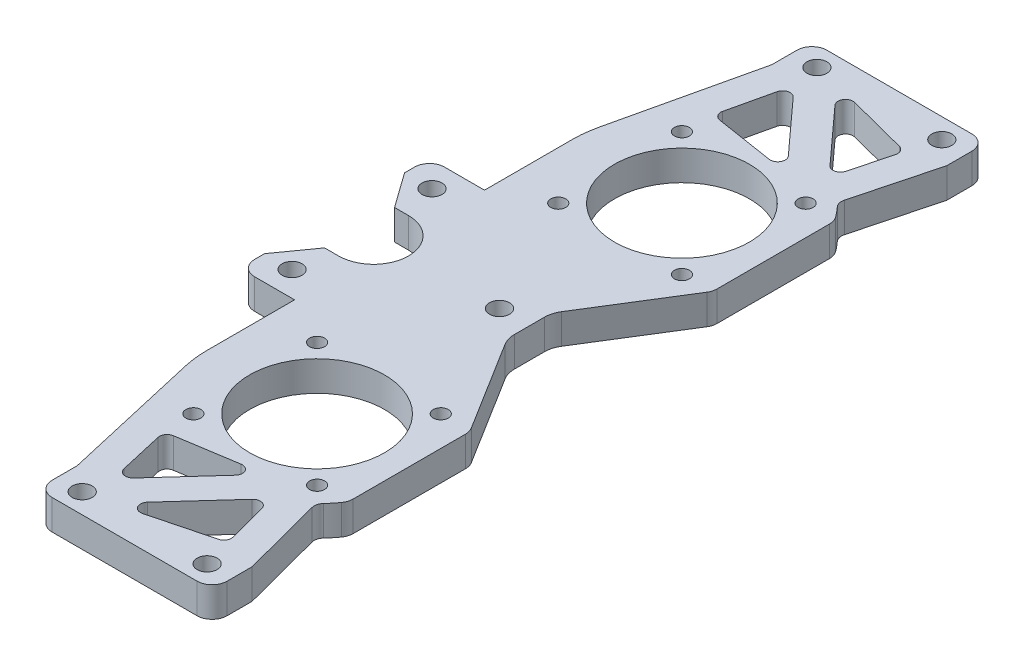
from build123d import *
from build123d.topology import SkipClean

# Parameters (mm, degrees)
SKETCH_1_W           = 44
SKETCH_1_H           = 131
SKETCH_1_R           = 1.6000000000000012
SKETCH_1_R_2         = 1.5999999999999979
SKETCH_1_R_3         = 1.5999999999999954
SKETCH_1_R_4         = 1.5999999999999988
SKETCH_1_H_2         = 9.999999999999986
SKETCH_1_R_5         = 1.600000000000003
SKETCH_1_R_6         = 1.600000000000006
EXTRUDE_1_DEPTH      = 6
SKETCH_2_R           = 2.300000000007249
EXTRUDE_2_DEPTH      = 6
CUT_EXTRUDE_1_DEPTH  = 6
FILLET_1_R           = 5
CUT_EXTRUDE_2_DEPTH  = 6
FILLET_2_R           = 2
SKETCH_4_R           = 1.5999999999999954
SKETCH_4_R_2         = 1.5999999999999985
SKETCH_4_R_3         = 1.5999999999999968
EXTRUDE_3_DEPTH      = 6
SKETCH_5_R           = 1.500000000006792
SKETCH_5_R_2         = 1.5000000000067926
EXTRUDE_4_DEPTH      = 6
CUT_EXTRUDE_3_DEPTH  = 6
EXTRUDE_5_DEPTH      = 6
CUT_EXTRUDE_4_DEPTH  = 10
CHAMFER_1_SIZE       = 4
CUT_EXTRUDE_5_DEPTH  = 10
SKETCH_8_R           = 7.000000000006796
CUT_EXTRUDE_6_DEPTH  = 10
SKETCH_11_R          = 2.100000000000002
EXTRUDE_6_DEPTH      = 6
SKETCH_9_R           = 7.499999999999999
CUT_EXTRUDE_7_DEPTH  = 10
SKETCH_10_W          = 32.19999999999607
SKETCH_10_H          = 60
CUT_EXTRUDE_8_DEPTH  = 10
CUT_EXTRUDE_10_DEPTH = 10
SKETCH_14_R          = 2.1
CUT_EXTRUDE_11_DEPTH = 10
EXTRUDE_7_DEPTH      = 6
FILLET_4_R           = 3
FILLET_5_R           = 3
SKETCH_18_R          = 1.600000000000006
SKETCH_18_R_2        = 2.100000000000005
SKETCH_18_R_3        = 1.6000000000000043
EXTRUDE_9_DEPTH      = 6
SKETCH_17_R          = 2.1
SKETCH_17_R_2        = 2
SKETCH_17_R_3        = 2.3000000000072487
SKETCH_17_R_4        = 1.9999999999999996
SKETCH_17_R_5        = 1.5999999999999968
SKETCH_17_R_6        = 1.4999999999999991
SKETCH_17_R_7        = 1.5999999999999985
SKETCH_17_R_8        = 1.5000000000000009
SKETCH_17_R_9        = 1.5999999999999974
SKETCH_17_R_10       = 1.6000000000000043
SKETCH_17_R_11       = 2.1000000000000085
SKETCH_17_R_12       = 1.9999999999999936
SKETCH_17_R_13       = 2.100000000000005
SKETCH_17_R_14       = 2.0999999999999988
SKETCH_17_R_15       = 2.100000000000027
SKETCH_17_R_16       = 1.6000000000000276
SKETCH_17_R_17       = 1.6000000000000207
SKETCH_17_R_18       = 1.6000000000000105
SKETCH_17_R_19       = 1.6000000000000045
SKETCH_17_R_20       = 2.3000000000120995
EXTRUDE_8_DEPTH      = 6
SKETCH_20_R          = 2.0000000000000018
CUT_EXTRUDE_12_DEPTH = 87.96694774453113
CUT_EXTRUDE_13_DEPTH = 85.44672877027268
FILLET_6_R           = 3


with BuildPart() as part:
    # 草图1 → 凸台-拉伸1 (new body)
    # profile 1 of 3: a face of its own
    with BuildSketch(Plane(origin=(0, 0, 0), x_dir=(1, 0, 0), z_dir=(0, 1, 0))):
        Rectangle(SKETCH_1_W, SKETCH_1_H)
        with Locations(Location((-12.374368670764605, -48.874368670764554, 0), (0, 0, 270))):
            Circle(SKETCH_1_R, mode=Mode.SUBTRACT)
        with Locations(Location((-12.374368670764358, -24.125631329235514, 0), (0, 0, 270))):
            Circle(SKETCH_1_R_2, mode=Mode.SUBTRACT)
        with Locations(Location((12.374368670764607, -48.874368670764895, 0), (0, 0, 270))):
            Circle(SKETCH_1_R_3, mode=Mode.SUBTRACT)
        with BuildLine():
            ThreePointArc((13.5, -36.5), (-9.545941546018376, -46.045941546018405), (-3.814e-14, -23))
            ThreePointArc((-3.814e-14, -23), (9.545941546018378, -26.954058453981595), (13.5, -36.5))
        make_face(mode=Mode.SUBTRACT)
        with Locations(Location((12.374368670764863, -24.125631329235695, 0), (0, 0, 270))):
            Circle(SKETCH_1_R_4, mode=Mode.SUBTRACT)
        with Locations(Location((-12.374368670764358, 24.125631329235514, 0), (0, 0, 270))):
            Circle(SKETCH_1_R_2, mode=Mode.SUBTRACT)
        with Locations(Location((-12.374368670764605, 48.874368670764554, 0), (0, 0, 270))):
            Circle(SKETCH_1_R, mode=Mode.SUBTRACT)
        with BuildLine():
            ThreePointArc((13.5, 36.5), (9.545941546018373, 26.954058453981588), (-5.044e-14, 23))
            ThreePointArc((-5.044e-14, 23), (-9.545941546018375, 46.04594154601841), (13.5, 36.5))
        make_face(mode=Mode.SUBTRACT)
        with Locations(Location((12.374368670764863, 24.125631329235695, 0), (0, 0, 270))):
            Circle(SKETCH_1_R_4, mode=Mode.SUBTRACT)
        with Locations(Location((12.374368670764607, 48.874368670764895, 0), (0, 0, 270))):
            Circle(SKETCH_1_R_3, mode=Mode.SUBTRACT)
    # profile 2 of 3: a face of its own
    with BuildSketch(Plane(origin=(0, 0, 0), x_dir=(1, 0, 0), z_dir=(0, 1, 0))):
        with Locations((0, 70.5)):
            Rectangle(SKETCH_1_W, SKETCH_1_H_2)
        with Locations(Location((-16.999999999999996, 70.5, 0), (0, 0, 270))):
            Circle(SKETCH_1_R_5, mode=Mode.SUBTRACT)
        with Locations(Location((16.999999999999996, 70.5, 0), (0, 0, 270))):
            Circle(SKETCH_1_R_6, mode=Mode.SUBTRACT)
    # profile 3 of 3: a face of its own
    with BuildSketch(Plane(origin=(0, 0, 0), x_dir=(1, 0, 0), z_dir=(0, 1, 0))):
        with Locations((0, -70.5)):
            Rectangle(SKETCH_1_W, SKETCH_1_H_2)
        with Locations(Location((-16.999999999999996, -70.5, 0), (0, 0, 270))):
            Circle(SKETCH_1_R_5, mode=Mode.SUBTRACT)
        with Locations(Location((16.999999999999996, -70.5, 0), (0, 0, 270))):
            Circle(SKETCH_1_R_6, mode=Mode.SUBTRACT)
    extrude(amount=EXTRUDE_1_DEPTH)

    # 草图2 → 凸台-拉伸2 (add)
    with BuildSketch(Plane.XZ):
        Polygon((-21.999999999999996, -19.000000000000007), (-22, 0), (-22, 18.999999999999993), (-33, 18.999999999999996), (-32.99999999999999, -19.00000000000001), align=None)
        with Locations(Location((-27.499999999996053, -13.999999999991697, 0), (0, 0, 270))):
            Circle(SKETCH_2_R, mode=Mode.SUBTRACT)
        with Locations(Location((-27.499999999996067, 14.000000000008303, 0), (0, 0, 270))):
            Circle(SKETCH_2_R, mode=Mode.SUBTRACT)
    extrude(amount=-EXTRUDE_2_DEPTH)

    # 草图2<3> → 切除-拉伸1 (cut)
    with BuildSketch(Plane.XZ):
        Polygon((5.999999999999998, 7.999999999999997), (5.999999999999998, -2.35e-15), (22, 0), (22, 8.000000000000002), align=None)
        Polygon((22, 0), (5.9999999999999964, 0), (5.999999999999999, -8.000000000000002), (22, -8.000000000000002), align=None)
    extrude(amount=-CUT_EXTRUDE_1_DEPTH, mode=Mode.SUBTRACT)

    # 圆角1
    fillet_1_edges = [part.edges().sort_by_distance(p)[0] for p in [
        (5.999999999999999, 3, -8.000000000000002),
        (5.999999999999999, 3, 7.999999999999998),
        (22, 3, 8.000000000000002),
        (22, 3, -8.000000000000002),
    ]]
    fillet(fillet_1_edges, radius=FILLET_1_R)

    # 草图3 → 切除-拉伸2 (cut)
    with BuildSketch(Plane.XZ):
        with BuildLine():
            ThreePointArc((-22, 36.5), (-20.144860004859353, 45.34220647715366), (-14.892307692307439, 52.69318287421101))
            Line((-14.892307692307686, 52.69318287421078), (-21.999999999999993, 60.42174742781138))
            Line((-22, 60.42174742781138), (-22, 36.49999999999999))
        make_face()
        with BuildLine():
            Line((-15.05896435190986, 65.30065264274246), (-10.193760484369747, 55.99582640431797))
            ThreePointArc((-10.193760484369832, 55.995826404317924), (1.35e-15, 58.5), (10.19376048436984, 55.995826404317924))
            Line((10.193760484369749, 55.99582640431797), (15.05896435190986, 65.30065264274246))
            ThreePointArc((15.058964351909855, 65.30065264274245), (1.99e-15, 69), (-15.058964351909852, 65.30065264274246))
        make_face()
        with BuildLine():
            Line((22, 60.42174742781138), (14.89230769230769, 52.69318287421078))
            ThreePointArc((14.89230769230745, 52.693182874211), (20.144860004859353, 45.34220647715365), (22, 36.5))
            Line((22, 36.5), (22, 60.42174742781138))
        make_face()
        with BuildLine():
            Line((-22, -36.50000000000003), (-22, -60.4217474278114))
            Line((-21.999999999999982, -60.4217474278114), (-14.892307692307668, -52.693182874210784))
            ThreePointArc((-14.892307692307435, -52.69318287421101), (-20.14486000485934, -45.34220647715367), (-21.999999999999986, -36.500000000000014))
        make_face()
        with BuildLine():
            ThreePointArc((-15.05896435190985, -65.30065264274245), (7.91e-15, -69), (15.058964351909868, -65.30065264274246))
            Line((15.058964351909875, -65.30065264274249), (10.193760484369765, -55.995826404317995))
            ThreePointArc((10.193760484369836, -55.99582640431795), (9.84e-15, -58.500000000000014), (-10.193760484369815, -55.995826404317945))
            Line((-10.193760484369738, -55.995826404317995), (-15.058964351909848, -65.30065264274249))
        make_face()
        with BuildLine():
            Line((14.892307692307709, -52.69318287421079), (22.000000000000014, -60.42174742781138))
            Line((22, -60.42174742781138), (22, -36.500000000000014))
            ThreePointArc((22.000000000000014, -36.50000000000002), (20.144860004859343, -45.34220647715373), (14.89230769230737, -52.6931828742111))
        make_face()
    extrude(amount=-CUT_EXTRUDE_2_DEPTH, mode=Mode.SUBTRACT)

    # 圆角2
    fillet_2_edges = [part.edges().sort_by_distance(p)[0] for p in [
        (14.892307692307567, 3, 52.69318287421088),
        (22, 3, 60.42174742781138),
        (10.193760484369793, 3, 55.995826404317945),
        (-10.19376048436979, 3, 55.995826404317945),
        (-15.058964351909859, 3, 65.30065264274246),
        (15.058964351909859, 3, 65.30065264274245),
        (15.058964351909871, 3, -65.30065264274248),
        (-15.058964351909848, 3, -65.30065264274248),
        (-10.193760484369776, 3, -55.99582640431797),
        (10.1937604843698, 3, -55.995826404317974),
        (-14.892307692307549, 3, -52.69318287421089),
        (-21.999999999999993, 3, -60.4217474278114),
        (22.000000000000007, 3, -60.42174742781138),
        (14.892307692307536, 3, -52.69318287421095),
        (-14.892307692307563, 3, 52.6931828742109),
        (-21.999999999999996, 3, 60.42174742781138),
        (-22, 3, -75.49999999999999),
        (22, 3, -75.49999999999999),
        (22, 3, 75.49999999999999),
        (-22, 3, 75.49999999999999),
    ]]
    fillet(fillet_2_edges, radius=FILLET_2_R)

    # 草图4 → 凸台-拉伸3 (add)
    with BuildSketch(Plane.XZ):
        Polygon((-32.99999999999999, -30), (-32.99999999999999, 29.999999999999993), (-55, 29.999999999999993), (-55, -30.000000000000007), align=None)
        with Locations(Location((-37.99999999999999, 24.999999999999993, 0), (0, 0, 270))):
            Circle(SKETCH_4_R, mode=Mode.SUBTRACT)
        with Locations(Location((-50, -25.000000000000007, 0), (0, 0, 270))):
            Circle(SKETCH_4_R_2, mode=Mode.SUBTRACT)
        with Locations(Location((-38.00000000000001, -25.000000000000007, 0), (0, 0, 270))):
            Circle(SKETCH_4_R_3, mode=Mode.SUBTRACT)
        with Locations(Location((-50, 24.999999999999993, 0), (0, 0, 270))):
            Circle(SKETCH_4_R_2, mode=Mode.SUBTRACT)
    extrude(amount=-EXTRUDE_3_DEPTH)

    # 草图5 → 凸台-拉伸4 (add)
    with BuildSketch(Plane.XZ):
        Polygon((-55, 14.999999999999984), (-65.19999999999607, 14.999999999999984), (-65.19999999999607, -15.000000000000009), (-55, -15.00000000000001), align=None)
        with Locations(Location((-61.19999999999606, -10.000000000000007, 0), (0, 0, 270))):
            Circle(SKETCH_5_R, mode=Mode.SUBTRACT)
        with Locations(Location((-61.19999999999606, 9.999999999999984, 0), (0, 0, 270))):
            Circle(SKETCH_5_R_2, mode=Mode.SUBTRACT)
    extrude(amount=-EXTRUDE_4_DEPTH)

    # 草图5<4> → 切除-拉伸3 (cut)
    with BuildSketch(Plane.XZ):
        with BuildLine():
            ThreePointArc((-34.000000000002835, 9.999999999999986), (-33.56066017178066, 8.939339828215356), (-32.49999999999603, 8.499999999993197))
            Line((-32.49999999999605, 8.499999999993197), (-32.49999999999605, 9.999999999999986))
            Line((-32.49999999999605, 9.999999999999986), (-34.000000000002835, 9.999999999999986))
        make_face()
        with BuildLine():
            Line((-32.49999999999605, 9.999999999999986), (-32.49999999999605, 8.499999999993197))
            ThreePointArc((-32.49999999999603, 8.499999999993197), (-31.43933982821142, 8.93933982821537), (-30.99999999998926, 9.999999999999986))
            ThreePointArc((-30.99999999998926, 9.999999999999986), (-32.49999999999605, 11.500000000006775), (-34.000000000002835, 9.999999999999986))
            Line((-34.000000000002835, 9.999999999999986), (-32.49999999999605, 9.999999999999986))
        make_face()
        with BuildLine():
            ThreePointArc((-30.99999999998926, -10.000000000000012), (-31.439339828211423, -8.939339828215395), (-32.499999999996035, -8.499999999993223))
            Line((-32.49999999999605, -8.499999999993221), (-32.49999999999605, -10.000000000000014))
            Line((-32.49999999999605, -10.000000000000012), (-34.000000000002835, -10.000000000000012))
            ThreePointArc((-34.000000000002835, -10.000000000000012), (-32.49999999999605, -11.500000000006802), (-30.99999999998926, -10.000000000000012))
        make_face()
        with BuildLine():
            Line((-32.49999999999605, -10.000000000000014), (-32.49999999999605, -8.499999999993221))
            ThreePointArc((-32.499999999996035, -8.499999999993223), (-33.56066017178067, -8.939339828215386), (-34.000000000002835, -10.000000000000012))
            Line((-34.000000000002835, -10.000000000000012), (-32.49999999999605, -10.000000000000012))
        make_face()
    extrude(amount=-CUT_EXTRUDE_3_DEPTH, mode=Mode.SUBTRACT)

    # 草图6 → 凸台-拉伸5 (add)
    with BuildSketch(Plane(origin=(0, 6, 0), x_dir=(1, 0, 0), z_dir=(0, 1, 0))):
        with BuildLine():
            Line((-12, 77.49999999999999), (-12, 75.49999999999999))
            Line((-12, 75.49999999999999), (-10.640312423743215, 75.49999999999999))
            ThreePointArc((-10.640312423743223, 75.50000000000004), (-9.999999999999943, 75.60000000000002), (-9.35968757625667, 75.5))
            Line((-9.359687576256672, 75.49999999999999), (5.359687576256704, 75.49999999999999))
            ThreePointArc((5.359687576256699, 75.50000000000001), (6.000000000000013, 75.60000000000002), (6.640312423743326, 75.5))
            Line((6.640312423743325, 75.49999999999999), (12, 75.49999999999999))
            Line((12, 75.49999999999999), (12, 77.49999999999999))
            Line((12, 77.49999999999999), (-12, 77.49999999999999))
        make_face()
        with BuildLine():
            Line((11.999999999999973, -77.49999999999999), (11.999999999999973, -75.49999999999999))
            Line((11.999999999999972, -75.49999999999999), (6.6403124237433, -75.49999999999999))
            ThreePointArc((6.640312423743301, -75.5), (5.999999999999985, -75.60000000000002), (5.35968757625667, -75.50000000000001))
            Line((5.359687576256675, -75.49999999999999), (-9.359687576256718, -75.49999999999999))
            ThreePointArc((-9.359687576256716, -75.5), (-10.000000000000162, -75.60000000000002), (-10.640312423743598, -75.49999999999993))
            Line((-10.640312423743605, -75.49999999999999), (-12.000000000000043, -75.49999999999999))
            Line((-12.000000000000043, -75.49999999999999), (-12.000000000000043, -77.49999999999999))
            Line((-12.000000000000043, -77.49999999999999), (11.999999999999972, -77.49999999999999))
        make_face()
    extrude(amount=-EXTRUDE_5_DEPTH)

    # 草图6<3> → 切除-拉伸4 (cut)
    with SkipClean():  # the faces are left unmerged after this step: merging them gives an invalid solid
        with BuildSketch(Plane(origin=(0, 6, 0), x_dir=(1, 0, 0), z_dir=(0, 1, 0))):
            with BuildLine():
                ThreePointArc((-10.640312423743598, -75.49999999999993), (-10.000000000000162, -75.60000000000002), (-9.359687576256716, -75.5))
                Line((-9.359687576256718, -75.49999999999999), (-10.640312423743605, -75.49999999999999))
            make_face()
            with BuildLine():
                Line((-10.640312423743605, -75.49999999999999), (-9.359687576256718, -75.49999999999999))
                ThreePointArc((-9.359687576256716, -75.5), (-8.303731140140114, -74.73801129036433), (-7.900000000000038, -73.50000000000001))
                ThreePointArc((-7.900000000000038, -73.50000000000001), (-11.23801129036426, -71.80373114014002), (-10.640312423743598, -75.49999999999993))
            make_face()
            with BuildLine():
                ThreePointArc((5.35968757625667, -75.50000000000001), (5.999999999999985, -75.60000000000002), (6.640312423743301, -75.5))
                Line((6.6403124237433, -75.49999999999999), (5.359687576256675, -75.49999999999999))
            make_face()
            with BuildLine():
                Line((5.359687576256675, -75.49999999999999), (6.6403124237433, -75.49999999999999))
                ThreePointArc((6.640312423743301, -75.5), (7.696268859859903, -74.73801129036433), (8.09999999999998, -73.50000000000001))
                ThreePointArc((8.09999999999998, -73.50000000000001), (4.76198870963565, -71.80373114014009), (5.35968757625667, -75.50000000000001))
            make_face()
            with BuildLine():
                ThreePointArc((6.640312423743326, 75.5), (6.000000000000013, 75.60000000000002), (5.359687576256699, 75.50000000000001))
                Line((5.359687576256704, 75.49999999999999), (6.640312423743325, 75.49999999999999))
            make_face()
            with BuildLine():
                Line((6.640312423743325, 75.49999999999999), (5.359687576256704, 75.49999999999999))
                ThreePointArc((5.359687576256699, 75.50000000000001), (4.761988709635677, 71.80373114014009), (8.100000000000007, 73.50000000000001))
                ThreePointArc((8.100000000000007, 73.50000000000001), (7.696268859859931, 74.73801129036433), (6.640312423743326, 75.5))
            make_face()
            with BuildLine():
                ThreePointArc((-9.35968757625667, 75.5), (-9.999999999999943, 75.60000000000002), (-10.640312423743223, 75.50000000000004))
                Line((-10.640312423743215, 75.49999999999999), (-9.359687576256672, 75.49999999999999))
            make_face()
            with BuildLine():
                Line((-9.359687576256672, 75.49999999999999), (-10.640312423743215, 75.49999999999999))
                ThreePointArc((-10.640312423743223, 75.50000000000004), (-11.238011290364359, 71.80373114014012), (-7.899999999999995, 73.50000000000001))
                ThreePointArc((-7.899999999999995, 73.50000000000001), (-8.30373114014007, 74.73801129036433), (-9.35968757625667, 75.5))
            make_face()
        extrude(amount=-CUT_EXTRUDE_4_DEPTH, mode=Mode.SUBTRACT)

    # 倒角1
    # the kernel refuses this chamfer: 4 mm, written as the material it adds along each edge
    with BuildSketch(Plane(origin=(-12, 6, -75.49999999999999), x_dir=(-1, 0, 0), z_dir=(0, -1, 0))) as chamfer_1_piece_1_section:
        Polygon((CHAMFER_1_SIZE, 0), (0, CHAMFER_1_SIZE), (0, 0), align=None)
    chamfer_1_piece_1 = extrude(amount=6, mode=Mode.PRIVATE)
    chamfer_1_piece_1 = split(chamfer_1_piece_1, bisect_by=Plane(origin=(-12, 6, -77.49999999999999), z_dir=(0, 0, 1)), keep=Keep.TOP, mode=Mode.PRIVATE)
    add(chamfer_1_piece_1)
    with BuildSketch(Plane(origin=(12, 6, -75.49999999999999), x_dir=(0, 0, -1), z_dir=(0, -1, 0))) as chamfer_1_piece_2_section:
        Polygon((CHAMFER_1_SIZE, 0), (0, CHAMFER_1_SIZE), (0, 0), align=None)
    chamfer_1_piece_2 = extrude(amount=6, mode=Mode.PRIVATE)
    chamfer_1_piece_2 = split(chamfer_1_piece_2, bisect_by=Plane(origin=(12, 6, -77.49999999999999), z_dir=(0, 0, 1)), keep=Keep.TOP, mode=Mode.PRIVATE)
    add(chamfer_1_piece_2)
    with BuildSketch(Plane(origin=(11.999999999999972, 6, 75.49999999999999), x_dir=(4.4e-16, 0, 1), z_dir=(0, -1, 0))) as chamfer_1_piece_3_section:
        Polygon((CHAMFER_1_SIZE, 0), (1.78e-15, -CHAMFER_1_SIZE), (0, 0), align=None)
    chamfer_1_piece_3 = extrude(amount=6, mode=Mode.PRIVATE)
    chamfer_1_piece_3 = split(chamfer_1_piece_3, bisect_by=Plane(origin=(11.999999999999972, 6, 77.49999999999999), z_dir=(0, 0, -1)), keep=Keep.TOP, mode=Mode.PRIVATE)
    add(chamfer_1_piece_3)
    with BuildSketch(Plane(origin=(-12.000000000000043, 6, 75.49999999999999), x_dir=(-1, 0, 0), z_dir=(0, -1, 0))) as chamfer_1_piece_4_section:
        Polygon((CHAMFER_1_SIZE, 0), (0, -CHAMFER_1_SIZE), (0, 0), align=None)
    chamfer_1_piece_4 = extrude(amount=6, mode=Mode.PRIVATE)
    chamfer_1_piece_4 = split(chamfer_1_piece_4, bisect_by=Plane(origin=(-12.000000000000043, 6, 77.49999999999999), z_dir=(0, 0, -1)), keep=Keep.TOP, mode=Mode.PRIVATE)
    add(chamfer_1_piece_4)

    # 草图7 → 切除-拉伸5 (cut)
    with BuildSketch(Plane(origin=(0, 6, 0), x_dir=(1, 0, 0), z_dir=(0, 1, 0))):
        Polygon((-25.199999999996066, 7.000000000000004), (-65.19999999999607, 7), (-65.19999999999607, -7), (-25.199999999996066, -6.999999999999996), align=None)
    extrude(amount=-CUT_EXTRUDE_5_DEPTH, mode=Mode.SUBTRACT)

    # 草图8 → 切除-拉伸6 (cut)
    with BuildSketch(Plane(origin=(0, 6, 0), x_dir=(1, 0, 0), z_dir=(0, 1, 0))):
        with Locations((-25.199999999996066, 0)):
            Circle(SKETCH_8_R)
    extrude(amount=-CUT_EXTRUDE_6_DEPTH, mode=Mode.SUBTRACT)

    # 草图11 → 凸台-拉伸6 (add)
    # profile 1 of 2: a face of its own
    with BuildSketch(Plane(origin=(0, 6, 0), x_dir=(1, 0, 0), z_dir=(0, 1, 0))):
        with BuildLine():
            Line((21.47210753401916, 59.847742416891464), (39.00000000000001, 69.49999999999997))
            Line((39.00000000000001, 69.49999999999997), (39.00000000000001, 77.49999999999999))
            Line((39.00000000000001, 77.49999999999999), (14.00000000000005, 77.49999999999999))
            Line((14.00000000000005, 77.49999999999999), (14.00000000000005, 69.5))
            Line((14.00000000000005, 69.5), (15.751000400320294, 69.5))
            ThreePointArc((15.751000400320303, 69.50000000000001), (16.999999999999975, 72.10000000000001), (18.248999599679713, 69.50000000000004))
            Line((18.248999599679728, 69.5), (22, 69.49999999999999))
            Line((22, 69.5), (22, 61.201588570737606))
            ThreePointArc((22, 61.201588570737606), (21.8633592069215, 60.47502648393371), (21.47210753401916, 59.847742416891464))
        make_face()
        with Locations(Location((31.000000000000004, 73.50000000000001, 0), (0, 0, 270))):
            Circle(SKETCH_11_R, mode=Mode.SUBTRACT)
    # profile 2 of 2: a face of its own
    with BuildSketch(Plane(origin=(0, 6, 0), x_dir=(1, 0, 0), z_dir=(0, 1, 0))):
        with BuildLine():
            Line((21.999999999999993, -61.201588570737606), (21.999999999999986, -69.5))
            Line((21.999999999999986, -69.49999999999999), (18.248999599679728, -69.5))
            ThreePointArc((18.248999599679713, -69.50000000000004), (16.999999999999982, -72.10000000000001), (15.751000400320294, -69.50000000000001))
            Line((15.751000400320292, -69.5), (14.00000000000004, -69.5))
            Line((14.00000000000004, -69.5), (14.000000000000036, -77.49999999999999))
            Line((14.000000000000036, -77.49999999999999), (39.00000000000001, -77.49999999999999))
            Line((39.00000000000001, -77.49999999999999), (39.00000000000001, -69.49999999999997))
            Line((39.00000000000001, -69.49999999999997), (21.47210753401915, -59.847742416891464))
            ThreePointArc((21.47210753401915, -59.847742416891464), (21.86335920692149, -60.47502648393371), (21.999999999999993, -61.201588570737606))
        make_face()
        with Locations(Location((30.99999999999999, -73.50000000000001, 0), (0, 0, 270))):
            Circle(SKETCH_11_R, mode=Mode.SUBTRACT)
    extrude(amount=-EXTRUDE_6_DEPTH)

    # 草图9 → 切除-拉伸7 (cut)
    with BuildSketch(Plane(origin=(0, 6, 0), x_dir=(1, 0, 0), z_dir=(0, 1, 0))):
        with Locations((22, -8)):
            Circle(SKETCH_9_R)
        with Locations((22, 8)):
            Circle(SKETCH_9_R)
    extrude(amount=-CUT_EXTRUDE_7_DEPTH, mode=Mode.SUBTRACT)

    # 草图10 → 切除-拉伸8 (cut)
    with BuildSketch(Plane(origin=(0, 6, 0), x_dir=(1, 0, 0), z_dir=(0, 1, 0))):
        with Locations((-49.09999999999803, 3.55e-15)):
            Rectangle(SKETCH_10_W, SKETCH_10_H)
        Polygon((-32.99999999999999, 14.000000000000004), (-32.99999999999999, -13.999999999999996), (-27.99999999999999, -6.999999999999996), (-27.999999999999993, 7.000000000000005), align=None)
    extrude(amount=-CUT_EXTRUDE_8_DEPTH, mode=Mode.SUBTRACT)

    # 草图13 → 切除-拉伸10 (cut)
    with BuildSketch(Plane(origin=(0, 6, 0), x_dir=(1, 0, 0), z_dir=(0, 1, 0))):
        with BuildLine():
            Line((7.464466094067261, 6.5355339059327395), (22, 26.000000000000007))
            Line((22, 26.000000000000007), (22, -26))
            Line((22, -26), (7.4644660940672605, -6.535533905932737))
            ThreePointArc((7.4644660940672605, -6.535533905932737), (6.380602337443563, -4.913417161825446), (5.999999999999998, -2.999999999999999))
            Line((5.999999999999998, -2.999999999999999), (5.999999999999998, 3.0000000000000018))
            ThreePointArc((5.999999999999998, 3.0000000000000018), (6.380602337443565, 4.913417161825452), (7.464466094067261, 6.5355339059327395))
        make_face()
    extrude(amount=-CUT_EXTRUDE_10_DEPTH, mode=Mode.SUBTRACT)

    # 草图14 → 切除-拉伸11 (cut)
    with BuildSketch(Plane.XZ):
        with Locations(Location((0, 0, 0), (0, 0, 270))):
            Circle(SKETCH_14_R)
    extrude(amount=-CUT_EXTRUDE_11_DEPTH, mode=Mode.SUBTRACT)

    # 草图16 → 凸台-拉伸7 (add)
    with BuildSketch(Plane(origin=(0, 6, 0), x_dir=(1, 0, 0), z_dir=(0, 1, 0))):
        Polygon((3.000000000000001, 77.49999999999999), (-7.000000000000001, 77.49999999999999), (-6.999999999999998, 55.499999999999986), (3.000000000000004, 55.499999999999986), align=None)
        Polygon((-7.000000000000037, -77.49999999999999), (-7.000000000000025, -55.499999999999986), (2.999999999999978, -55.499999999999986), (2.9999999999999636, -77.49999999999999), align=None)
    extrude(amount=-EXTRUDE_7_DEPTH)

    # 圆角4
    # the kernel refuses this fillet: 3 mm, written as the material it adds along each edge
    with BuildSketch(Plane(origin=(3.000000000000002, 6, -68.86124225056881), x_dir=(0.9889750159305115, 0, 0.14808246981072612), z_dir=(0, -1, 0))) as fillet_4_piece_1:
        with BuildLine():
            CenterArc((3.481934557248917, 2.9952653058202774), FILLET_4_R, 171.48418080684652, 101.73525747445501)
            Line((0.5150095094573806, 3.439512715252442), (0, 0))
            ThreePointArc((0, 0), (1.8252076308159657, -0.05129252028039473), (3.650415261631931, 1e-17))
        make_face()
    extrude(amount=6)
    with BuildSketch(Plane(origin=(-6.999999999999998, 6, -68.2372021451167), x_dir=(-4.5e-16, 0, 1), z_dir=(0, -1, 0))) as fillet_4_piece_2:
        with BuildLine():
            CenterArc((3.983823972360882, 3), FILLET_4_R, 160.18507185149306, 109.81492814850691)
            ThreePointArc((1.1614465310636763, 4.016949152542375), (0.5160531224182288, 2.0271730736955695), (0, 0))
            Line((0, 0), (3.983823972360881, 0))
        make_face()
    extrude(amount=6)
    with BuildSketch(Plane(origin=(3.0000000000000036, 6, -58.29449471770339), x_dir=(0, 0, -1), z_dir=(0, -1, 0))) as fillet_4_piece_3:
        with BuildLine():
            CenterArc((2.474827481319835, 3), FILLET_4_R, 193.88654036262892, 76.11345963737108)
            ThreePointArc((-0.43749118256295105, 2.280000000000003), (-0.18864943531983158, 1.14577491353608), (0, 0))
            Line((0, 0), (2.474827481319835, 0))
        make_face()
    extrude(amount=6)
    with BuildSketch(Plane(origin=(-6.999999999999997, 6, -57.35665361461422), x_dir=(-0.9355165636527262, 0, 0.3532828316397426), z_dir=(0, -1, 0))) as fillet_4_piece_4:
        with BuildLine():
            CenterArc((2.086538932486849, 2.966485133421304), FILLET_4_R, 200.68823974678753, 60.73939049658128)
            Line((-0.7200107584713293, 1.906636638502076), (0, 0))
            ThreePointArc((0, 0), (0.8196817020487687, 0.01527525968270757), (1.6393634040973872, 5e-17))
        make_face()
    extrude(amount=6)
    with BuildSketch(Plane(origin=(-7.000000000000026, 6, 57.356653614614196), x_dir=(-4.4e-16, 0, 1), z_dir=(0, -1, 0))) as fillet_4_piece_5:
        with BuildLine():
            CenterArc((2.0380575957497142, 3), FILLET_4_R, 209.26060950341883, 60.73939049658111)
            ThreePointArc((-0.5791589454860493, 1.5336516183792164), (-0.2752892142958029, 0.772222296184416), (0, 0))
            Line((0, 0), (2.038057595749713, 0))
        make_face()
    extrude(amount=6)
    with BuildSketch(Plane(origin=(2.999999999999976, 6, 58.29449471770337), x_dir=(0.9820838764719788, 0, -0.18844431425164032), z_dir=(0, -1, 0))) as fillet_4_piece_6:
        with BuildLine():
            CenterArc((2.4798844618075044, 2.995821109208881), FILLET_4_R, 190.86201006285665, 76.11345963737108)
            Line((-0.4663671676084318, 2.43048816645396), (0, 0))
            ThreePointArc((0, 0), (1.160796982122668, 0.03064519913488969), (2.3215939642453285, 2e-17))
        make_face()
    extrude(amount=6)
    with BuildSketch(Plane(origin=(-7.000000000000032, 6, 68.2372021451167), x_dir=(-0.9606507391599529, 0, -0.2777591714983255), z_dir=(0, -1, 0))) as fillet_4_piece_7:
        with BuildLine():
            CenterArc((3.9884958634379744, 2.9937859292366316), FILLET_4_R, 163.87348951821895, 109.81492814850691)
            Line((1.1065436459581155, 3.8270634437316082), (0, 0))
            ThreePointArc((0, 0), (2.0907437993828095, -0.06731909993650714), (4.181487598765617, 8e-17))
        make_face()
    extrude(amount=6)
    with BuildSketch(Plane(origin=(2.9999999999999694, 6, 68.86124225056881), x_dir=(6.4e-16, 0, -1), z_dir=(0, -1, 0))) as fillet_4_piece_8:
        with BuildLine():
            CenterArc((3.477856022496441, 3), FILLET_4_R, 168.26474252554453, 101.73525747445541)
            ThreePointArc((0.5405625077772266, 3.6101694915254274), (0.21955423282719383, 1.8126802688486559), (0, 0))
            Line((0, 0), (3.4778560224964394, 0))
        make_face()
    extrude(amount=6)
    # the kernel refuses this fillet: 3 mm, written as the material it takes off along each edge
    with BuildSketch(Plane(origin=(39.00000000000001, 10.431893605808988, 69.49999999999997), x_dir=(0, 0, 1), z_dir=(0, -1, 0))) as fillet_4_2_piece_1:
        with BuildLine():
            CenterArc((FILLET_4_R * 0.590919147441, FILLET_4_R), FILLET_4_R, 208.84069211093257, 61.15930788906746)
            Line((-FILLET_4_R * 0.285045164716, FILLET_4_R * 0.517624084529), (0, 0))
            Line((0, 0), (FILLET_4_R * 0.590919147441, 0))
        make_face()
    extrude(amount=14.863787211617975, mode=Mode.SUBTRACT)
    with BuildSketch(Plane(origin=(39.00000000000001, 13.5, 77.49999999999999), x_dir=(-1, 0, 4.74e-15), z_dir=(0, -1, 0))) as fillet_4_2_piece_2:
        with BuildLine():
            CenterArc((FILLET_4_R, FILLET_4_R), FILLET_4_R, 180, 90.00000000000028)
            Line((-1.421e-14, FILLET_4_R), (0, 0))
            Line((0, 0), (FILLET_4_R, 0))
        make_face()
    extrude(amount=21, mode=Mode.SUBTRACT)
    with BuildSketch(Plane(origin=(39.00000000000001, 13.5, -77.49999999999999), x_dir=(0, 0, 1), z_dir=(0, -1, 0))) as fillet_4_2_piece_3:
        with BuildLine():
            CenterArc((FILLET_4_R, FILLET_4_R), FILLET_4_R, 180, 90)
            Line((0, FILLET_4_R), (0, 0))
            Line((0, 0), (FILLET_4_R, 0))
        make_face()
    extrude(amount=21, mode=Mode.SUBTRACT)
    with BuildSketch(Plane(origin=(39.00000000000001, 10.431893605808988, -69.49999999999997), x_dir=(-0.8759643121574832, 0, 0.48237591547098146), z_dir=(0, -1, 0))) as fillet_4_2_piece_4:
        with BuildLine():
            CenterArc((FILLET_4_R * 0.590919147441, FILLET_4_R), FILLET_4_R, 208.8406921109323, 61.15930788906752)
            Line((-FILLET_4_R * 0.285045164716, FILLET_4_R * 0.517624084529), (0, 0))
            Line((0, 0), (FILLET_4_R * 0.590919147441, 0))
        make_face()
    extrude(amount=14.863787211617975, mode=Mode.SUBTRACT)

    # 圆角5
    fillet_5_edges = [part.edges().sort_by_distance(p)[0] for p in [
        (-33, 3, 18.999999999999996),
        (-32.99999999999999, 3, -19.00000000000001),
    ]]
    fillet(fillet_5_edges, radius=FILLET_5_R)

    # 草图18 → 凸台-拉伸9 (add)
    with BuildSketch(Plane(origin=(0, 6, 0), x_dir=(1, 0, 0), z_dir=(0, 1, 0))):
        with Locations((16.999999999999996, -70.5)):
            Circle(SKETCH_18_R)
        with Locations((5.999999999999974, -73.50000000000001)):
            Circle(SKETCH_18_R_2)
        with Locations((-16.999999999999996, -70.5)):
            Circle(SKETCH_18_R_3)
        with Locations((16.999999999999996, 70.5)):
            Circle(SKETCH_18_R)
        with Locations((6.000000000000002, 73.50000000000001)):
            Circle(SKETCH_18_R_2)
        with Locations((-16.999999999999996, 70.5)):
            Circle(SKETCH_18_R_3)
        with BuildLine():
            Line((-22, 73.49999999999999), (-22, 77.49999999999999))
            Line((-22, 77.49999999999999), (-14.00000000000005, 77.49999999999999))
            Line((-14.00000000000005, 77.49999999999999), (-16.00000000000003, 75.49999999999999))
            Line((-16.00000000000003, 75.49999999999999), (-19.999999999999996, 75.49999999999999))
            ThreePointArc((-19.999999999999996, 75.49999999999999), (-21.414213562373092, 74.91421356237308), (-22, 73.49999999999999))
        make_face()
        with BuildLine():
            Line((-21.472107534019177, 59.84774241689151), (-16.18964531373727, 54.10384573368517))
            ThreePointArc((-16.18964531373727, 54.10384573368517), (-15.661752859607109, 52.74978185804246), (-16.189940110443377, 51.39583294818576))
            ThreePointArc((-16.189940110443377, 51.39583294818576), (-20.49608111846937, 44.49441422401435), (-22, 36.500000000000014))
            Line((-22, 36.500000000000014), (-22, 61.20158857073767))
            ThreePointArc((-22, 61.20158857073767), (-21.863359206921512, 60.475026483933775), (-21.472107534019177, 59.84774241689151))
        make_face()
        with BuildLine():
            Line((-21.47210753401917, -59.847742416891485), (-16.18964531373727, -54.10384573368516))
            ThreePointArc((-16.18964531373727, -54.10384573368516), (-15.66175285960712, -52.74978185804245), (-16.18994011044339, -51.39583294818575))
            ThreePointArc((-16.18994011044339, -51.39583294818575), (-20.496081118469387, -44.49441422401433), (-22, -36.5))
            Line((-22, -36.5), (-22, -61.201588570737634))
            ThreePointArc((-22, -61.201588570737634), (-21.863359206921515, -60.47502648393374), (-21.47210753401917, -59.847742416891485))
        make_face()
        with BuildLine():
            Line((-19.999999999999996, -75.49999999999999), (-16.00000000000011, -75.49999999999999))
            Line((-16.00000000000011, -75.49999999999999), (-14.00000000000009, -77.49999999999999))
            Line((-14.00000000000009, -77.49999999999999), (-22, -77.49999999999999))
            Line((-22, -77.49999999999999), (-22, -73.49999999999999))
            ThreePointArc((-22, -73.49999999999999), (-21.414213562373096, -74.91421356237308), (-19.999999999999996, -75.49999999999999))
        make_face()
        with BuildLine():
            Line((11.081785984074296, 57.694197776825035), (14.10184233412252, 63.47013242057871))
            ThreePointArc((14.10184233412252, 63.47013242057871), (14.217370431844792, 65.05708362142856), (13.137985920442524, 66.22613876631566))
            ThreePointArc((13.137985920442524, 66.22613876631566), (9.929460509984619, 67.44601450882902), (6.610169491525427, 68.32067974279157))
            ThreePointArc((6.610169491525427, 68.32067974279157), (4.106657515737886, 67.71045611041112), (3.0000000000000027, 65.38338622807235))
            Line((3.0000000000000027, 65.38338622807235), (3.000000000000003, 60.7693221990232))
            ThreePointArc((3.000000000000003, 60.7693221990232), (3.6377976377964596, 58.91999799813251), (5.280000000000006, 57.85700353514042))
            ThreePointArc((5.280000000000006, 57.85700353514042), (6.9278840641578405, 57.38071891467314), (8.53365161837494, 56.77749466912043))
            ThreePointArc((8.53365161837494, 56.77749466912043), (9.986468243012784, 56.738981325666444), (11.081785984074296, 57.694197776825035))
        make_face()
        with BuildLine():
            Line((-6.999999999999999, 64.25337817275583), (-6.999999999999999, 59.394711210353776))
            ThreePointArc((-6.999999999999999, 59.394711210353776), (-7.4116564037134465, 57.87797872650491), (-8.533651618374911, 56.77749466912043))
            ThreePointArc((-8.533651618374911, 56.77749466912043), (-9.986468243012753, 56.738981325666444), (-11.081785984074264, 57.694197776825035))
            Line((-11.081785984074264, 57.694197776825035), (-14.10184233412249, 63.47013242057871))
            ThreePointArc((-14.10184233412249, 63.47013242057871), (-14.217370431844774, 65.05708362142856), (-13.137985920442492, 66.22613876631566))
            ThreePointArc((-13.137985920442492, 66.22613876631566), (-12.084936255190527, 66.66959256781539), (-11.016949152542372, 67.07575561405304))
            ThreePointArc((-11.016949152542372, 67.07575561405304), (-8.27530400615458, 66.70805202661373), (-6.999999999999999, 64.25337817275583))
        make_face()
        with BuildLine():
            Line((-7.000000000000027, -59.39471121035377), (-7.000000000000029, -64.25337817275583))
            ThreePointArc((-7.000000000000029, -64.25337817275583), (-8.275304006154606, -66.70805202661373), (-11.0169491525424, -67.07575561405304))
            ThreePointArc((-11.0169491525424, -67.07575561405304), (-12.084936255190552, -66.66959256781539), (-13.137985920442517, -66.22613876631566))
            ThreePointArc((-13.137985920442517, -66.22613876631566), (-14.217370431844786, -65.05708362142856), (-14.101842334122516, -63.47013242057871))
            Line((-14.101842334122516, -63.47013242057871), (-11.081785984074285, -57.694197776825035))
            ThreePointArc((-11.081785984074285, -57.694197776825035), (-9.986468243012775, -56.73898132566644), (-8.533651618374924, -56.777494669120415))
            ThreePointArc((-8.533651618374924, -56.777494669120415), (-7.411656403713465, -57.87797872650491), (-7.000000000000027, -59.39471121035377))
        make_face()
        with BuildLine():
            Line((11.081785984074285, -57.694197776825035), (14.101842334122516, -63.47013242057871))
            ThreePointArc((14.101842334122516, -63.47013242057871), (14.217370431844799, -65.05708362142856), (13.137985920442517, -66.22613876631566))
            ThreePointArc((13.137985920442517, -66.22613876631566), (9.929460509984594, -67.44601450882902), (6.610169491525394, -68.3206797427916))
            ThreePointArc((6.610169491525394, -68.3206797427916), (4.106657515737849, -67.71045611041113), (2.9999999999999716, -65.38338622807237))
            Line((2.9999999999999716, -65.38338622807237), (2.9999999999999747, -60.7693221990232))
            ThreePointArc((2.9999999999999747, -60.7693221990232), (3.6377976377964267, -58.9199979981325), (5.279999999999977, -57.85700353514041))
            ThreePointArc((5.279999999999977, -57.85700353514041), (6.9278840641578165, -57.380718914673125), (8.533651618374924, -56.777494669120415))
            ThreePointArc((8.533651618374924, -56.777494669120415), (9.986468243012775, -56.73898132566643), (11.081785984074285, -57.694197776825035))
        make_face()
    extrude(amount=-EXTRUDE_9_DEPTH)

    # 草图17 → 凸台-拉伸8 (add)
    # profile 1 of 15: a face of its own
    with BuildSketch(Plane.XZ):
        Circle(SKETCH_17_R)
        with Locations(Location((0, 0, 0), (0, 0, 270))):
            Circle(SKETCH_17_R_2, mode=Mode.SUBTRACT)
    # profile 2 of 15: a face of its own
    with BuildSketch(Plane.XZ):
        with Locations((-27.499999999996067, 14.000000000008303)):
            Circle(SKETCH_17_R_3)
        with Locations(Location((-27.499999999996067, 14.000000000008303, 0), (0, 0, 270))):
            Circle(SKETCH_17_R_4, mode=Mode.SUBTRACT)
    # profile 3 of 15: a face of its own
    with BuildSketch(Plane.XZ):
        with Locations((12.374368670764863, 24.125631329235695)):
            Circle(SKETCH_17_R_5)
        with Locations(Location((12.374368670764852, 24.125631329235702, 0), (0, 0, 270))):
            Circle(SKETCH_17_R_6, mode=Mode.SUBTRACT)
    # profile 4 of 15: a face of its own
    with BuildSketch(Plane.XZ):
        with Locations((-12.374368670764358, 24.125631329235514)):
            Circle(SKETCH_17_R_7)
        with Locations(Location((-12.374368670764367, 24.12563132923551, 0), (0, 0, 270))):
            Circle(SKETCH_17_R_8, mode=Mode.SUBTRACT)
    # profile 5 of 15: a face of its own
    with BuildSketch(Plane.XZ):
        with Locations((12.374368670764607, 48.874368670764895)):
            Circle(SKETCH_17_R_9)
        with Locations(Location((12.374368670764582, 48.874368670764895, 0), (0, 0, 270))):
            Circle(SKETCH_17_R_8, mode=Mode.SUBTRACT)
    # profile 6 of 15: a face of its own
    with BuildSketch(Plane.XZ):
        with Locations((-12.374368670764605, 48.874368670764554)):
            Circle(SKETCH_17_R_10)
        with Locations(Location((-12.37436867076463, 48.874368670764554, 0), (0, 0, 270))):
            Circle(SKETCH_17_R_6, mode=Mode.SUBTRACT)
    # profile 7 of 15: a face of its own
    with BuildSketch(Plane.XZ):
        with Locations((30.99999999999999, 73.50000000000001)):
            Circle(SKETCH_17_R_11)
        with Locations(Location((30.999999999999968, 73.50000000000004, 0), (0, 0, 270))):
            Circle(SKETCH_17_R_12, mode=Mode.SUBTRACT)
    # profile 8 of 15: a face of its own
    with BuildSketch(Plane.XZ):
        with Locations((-10.000000000000043, 73.50000000000001)):
            Circle(SKETCH_17_R_13)
        with Locations(Location((-10.000000000000036, 73.50000000000001, 0), (0, 0, 270))):
            Circle(SKETCH_17_R_2, mode=Mode.SUBTRACT)
    # profile 9 of 15: a face of its own
    with BuildSketch(Plane.XZ):
        with Locations((-10, -73.50000000000001)):
            Circle(SKETCH_17_R_14)
        with Locations(Location((-10, -73.50000000000001, 0), (0, 0, 270))):
            Circle(SKETCH_17_R_2, mode=Mode.SUBTRACT)
    # profile 10 of 15: a face of its own
    with BuildSketch(Plane.XZ):
        with Locations((31.000000000000004, -73.50000000000001)):
            Circle(SKETCH_17_R_15)
        with Locations(Location((31.000000000000004, -73.50000000000001, 0), (0, 0, 270))):
            Circle(SKETCH_17_R_2, mode=Mode.SUBTRACT)
    # profile 11 of 15: a face of its own
    with BuildSketch(Plane.XZ):
        with Locations((-12.374368670764605, -48.874368670764554)):
            Circle(SKETCH_17_R_16)
        with Locations(Location((-12.374368670764605, -48.874368670764554, 0), (0, 0, 270))):
            Circle(SKETCH_17_R_6, mode=Mode.SUBTRACT)
    # profile 12 of 15: a face of its own
    with BuildSketch(Plane.XZ):
        with Locations((12.374368670764607, -48.874368670764895)):
            Circle(SKETCH_17_R_17)
        with Locations(Location((12.374368670764607, -48.874368670764895, 0), (0, 0, 270))):
            Circle(SKETCH_17_R_8, mode=Mode.SUBTRACT)
    # profile 13 of 15: a face of its own
    with BuildSketch(Plane.XZ):
        with Locations((-12.374368670764358, -24.125631329235514)):
            Circle(SKETCH_17_R_18)
        with Locations(Location((-12.374368670764358, -24.125631329235514, 0), (0, 0, 270))):
            Circle(SKETCH_17_R_8, mode=Mode.SUBTRACT)
    # profile 14 of 15: a face of its own
    with BuildSketch(Plane.XZ):
        with Locations((12.374368670764863, -24.125631329235695)):
            Circle(SKETCH_17_R_19)
        with Locations(Location((12.374368670764863, -24.125631329235695, 0), (0, 0, 270))):
            Circle(SKETCH_17_R_6, mode=Mode.SUBTRACT)
    # profile 15 of 15: a face of its own
    with BuildSketch(Plane.XZ):
        with Locations((-27.499999999996053, -13.999999999991697)):
            Circle(SKETCH_17_R_20)
        with Locations(Location((-27.499999999996053, -13.999999999991697, 0), (0, 0, 270))):
            Circle(SKETCH_17_R_4, mode=Mode.SUBTRACT)
    extrude(amount=-EXTRUDE_8_DEPTH)

    # 草图20 → 切除-拉伸12 (cut, through all)
    with BuildSketch(Plane(origin=(0, 6, 0), x_dir=(1, 0, 0), z_dir=(0, 1, 0))):
        with Locations(Location((15.000000000000002, 73.50000000000001, 0), (0, 0, 270))):
            Circle(SKETCH_20_R)
        with Locations(Location((15.000000000000002, -73.50000000000001, 0), (0, 0, 270))):
            Circle(SKETCH_20_R)
        with BuildLine():
            Line((18.374368670764614, 24.30211258017589), (6.7555956636419, 5.642921078939854))
            ThreePointArc((6.7555956636419, 5.642921078939854), (7.08451162966956, 6.1094936600364855), (7.46446609406726, 6.535533905932738))
            Line((7.46446609406726, 6.535533905932738), (22, 26.000000000000007))
            Line((22, 26.000000000000007), (22, 36.500000000000014))
            ThreePointArc((22, 36.500000000000014), (21.074108649677466, 42.81521532662105), (18.374368670764614, 48.598866721756394))
            Line((18.374368670764614, 48.598866721756394), (18.374368670764614, 24.30211258017589))
        make_face()
        with BuildLine():
            Line((15.727558209867105, 53.25881300611638), (20.000000000000004, 69.49999999999997))
            Line((20.000000000000004, 69.49999999999997), (20.000000000000004, 77.49999999999999))
            Line((20.000000000000004, 77.49999999999999), (36.00000000000001, 77.49999999999999))
            ThreePointArc((36.00000000000001, 77.49999999999999), (38.12132034355965, 76.62132034355963), (39.00000000000001, 74.49999999999999))
            Line((39.00000000000001, 74.49999999999999), (39.00000000000001, 71.27275744232355))
            ThreePointArc((39.00000000000001, 71.27275744232355), (38.58276820865122, 69.74655025442914), (37.44712774641295, 68.64486450585112))
            Line((37.44712774641295, 68.64486450585112), (21.47210753401916, 59.84774241689145))
            Line((21.47210753401916, 59.84774241689145), (16.189645313737287, 54.10384573368517))
            ThreePointArc((16.189645313737287, 54.10384573368517), (15.906975454679838, 53.70956005252808), (15.727558209867105, 53.25881300611638))
        make_face()
        with BuildLine():
            Line((20.000000000000004, -69.49999999999997), (20.000000000000004, -77.49999999999999))
            Line((20.000000000000004, -77.49999999999999), (36.00000000000001, -77.49999999999999))
            ThreePointArc((36.00000000000001, -77.49999999999999), (38.12132034355965, -76.62132034355963), (39.00000000000001, -74.49999999999999))
            Line((39.00000000000001, -74.49999999999999), (39.00000000000001, -71.27275744232355))
            ThreePointArc((39.00000000000001, -71.27275744232355), (38.58276820865122, -69.74655025442914), (37.44712774641295, -68.64486450585112))
            Line((37.44712774641295, -68.64486450585112), (21.47210753401916, -59.84774241689145))
            Line((21.47210753401916, -59.84774241689145), (16.189645313737287, -54.10384573368517))
            ThreePointArc((16.189645313737287, -54.10384573368517), (15.906975454679838, -53.70956005252808), (15.727558209867105, -53.25881300611638))
            Line((15.727558209867105, -53.25881300611638), (20.000000000000004, -69.49999999999997))
        make_face()
        with BuildLine():
            Line((-21.442813654771143, 41.41993318722523), (-15, 69.49999999999997))
            Line((-15, 69.49999999999997), (-15.000000000000002, 77.49999999999999))
            Line((-15.000000000000002, 77.49999999999999), (-22, 77.49999999999999))
            Line((-22, 77.49999999999999), (-22, 36.5))
            ThreePointArc((-22, 36.5), (-21.860259609677158, 38.975691781607196), (-21.442813654771143, 41.41993318722523))
        make_face()
        with BuildLine():
            Line((-15.000000000000002, -77.49999999999999), (-22, -77.49999999999999))
            Line((-22, -77.49999999999999), (-22, -36.5))
            ThreePointArc((-22, -36.5), (-21.86025960967716, -38.975691781607196), (-21.442813654771143, -41.41993318722523))
            Line((-21.442813654771143, -41.41993318722523), (-15, -69.49999999999997))
            Line((-15, -69.49999999999997), (-15.000000000000002, -77.49999999999999))
        make_face()
        with BuildLine():
            Line((18.374368670764614, -24.30211258017589), (18.374368670764614, -48.598866721756394))
            ThreePointArc((18.374368670764614, -48.598866721756394), (21.074108649677466, -42.81521532662105), (22, -36.500000000000014))
            Line((22, -36.500000000000014), (22, -26.000000000000007))
            Line((22, -26.000000000000007), (7.46446609406726, -6.535533905932738))
            ThreePointArc((7.46446609406726, -6.535533905932738), (7.08451162966956, -6.1094936600364855), (6.7555956636419, -5.642921078939854))
            Line((6.7555956636419, -5.642921078939854), (18.374368670764614, -24.30211258017589))
        make_face()
    extrude(amount=-CUT_EXTRUDE_12_DEPTH, mode=Mode.SUBTRACT)

    # 草图21 → 切除-拉伸13 (cut, through all)
    with BuildSketch(Plane(origin=(0, 6, 0), x_dir=(1, 0, 0), z_dir=(0, 1, 0))):
        with BuildLine():
            Line((-11.829997782779419, 56.48636125035723), (-9.803551637493085, 65.31833221850583))
            ThreePointArc((-9.803551637493085, 65.31833221850583), (-8.72135734509498, 66.43399904375542), (-7.231349510283193, 65.99158113762927))
            Line((-7.231349510283193, 65.99158113762927), (2.470325677641939, 55.31374347573344))
            ThreePointArc((2.470325677641939, 55.31374347573344), (2.680311626211189, 53.59291402650308), (1.1269221991398422, 52.82328464829696))
            Line((1.1269221991398422, 52.82328464829696), (-10.601199134071628, 54.66915134204416))
            ThreePointArc((-10.601199134071628, 54.66915134204416), (-11.610568485540629, 55.3106772794185), (-11.829997782779419, 56.48636125035723))
        make_face()
        with BuildLine():
            Line((-0.1673891503483887, 71.23636104589727), (11.87450408849264, 68.11223622550135))
            ThreePointArc((11.87450408849264, 68.11223622550135), (12.792134208991797, 67.41842312677892), (12.948463645801342, 66.27869387770572))
            Line((12.948463645801342, 66.27869387770572), (10.882083157274506, 58.42359050516032))
            ThreePointArc((10.882083157274506, 58.42359050516032), (9.788210654711499, 57.3482473542991), (8.321245073563809, 57.796501665706835))
            Line((8.321245073563809, 57.796501665706835), (-1.6542676767503883, 68.77572985864815))
            ThreePointArc((-1.6542676767503883, 68.77572985864815), (-1.827891799387681, 70.56019670534077), (-0.1673891503483887, 71.23636104589727))
        make_face()
        with BuildLine():
            Line((12.948463645801342, -66.27869387770572), (10.882083157274506, -58.42359050516032))
            ThreePointArc((10.882083157274506, -58.42359050516032), (9.788210654711499, -57.3482473542991), (8.321245073563809, -57.796501665706835))
            Line((8.321245073563809, -57.796501665706835), (-1.6542676767503883, -68.77572985864815))
            ThreePointArc((-1.6542676767503883, -68.77572985864815), (-1.827891799387681, -70.56019670534077), (-0.1673891503483887, -71.23636104589727))
            Line((-0.1673891503483887, -71.23636104589727), (11.87450408849264, -68.11223622550135))
            ThreePointArc((11.87450408849264, -68.11223622550135), (12.792134208991797, -67.41842312677892), (12.948463645801342, -66.27869387770572))
        make_face()
        with BuildLine():
            Line((1.1269221991398422, -52.82328464829696), (-10.601199134071628, -54.66915134204416))
            ThreePointArc((-10.601199134071628, -54.66915134204416), (-11.610568485540629, -55.3106772794185), (-11.829997782779419, -56.48636125035723))
            Line((-11.829997782779419, -56.48636125035723), (-9.803551637493085, -65.31833221850583))
            ThreePointArc((-9.803551637493085, -65.31833221850583), (-8.72135734509498, -66.43399904375542), (-7.231349510283193, -65.99158113762927))
            Line((-7.231349510283193, -65.99158113762927), (2.470325677641939, -55.31374347573344))
            ThreePointArc((2.470325677641939, -55.31374347573344), (2.680311626211189, -53.59291402650308), (1.1269221991398422, -52.82328464829696))
        make_face()
    extrude(amount=-CUT_EXTRUDE_13_DEPTH, mode=Mode.SUBTRACT)

    # 圆角6
    fillet_6_edges = [part.edges().sort_by_distance(p)[0] for p in [
        (20.000000000000004, 3, -77.49999999999999),
        (18.374368670764614, 3, 48.598866721756394),
        (18.374368670764614, 3, 24.30211258017589),
        (18.374368670764614, 3, -48.598866721756394),
        (18.374368670764614, 3, -24.30211258017589),
        (-15.000000000000002, 3, 77.49999999999999),
        (-15.000000000000002, 3, -77.49999999999999),
        (20.000000000000004, 3, 77.49999999999999),
    ]]
    fillet(fillet_6_edges, radius=FILLET_6_R)


solid = part.part
